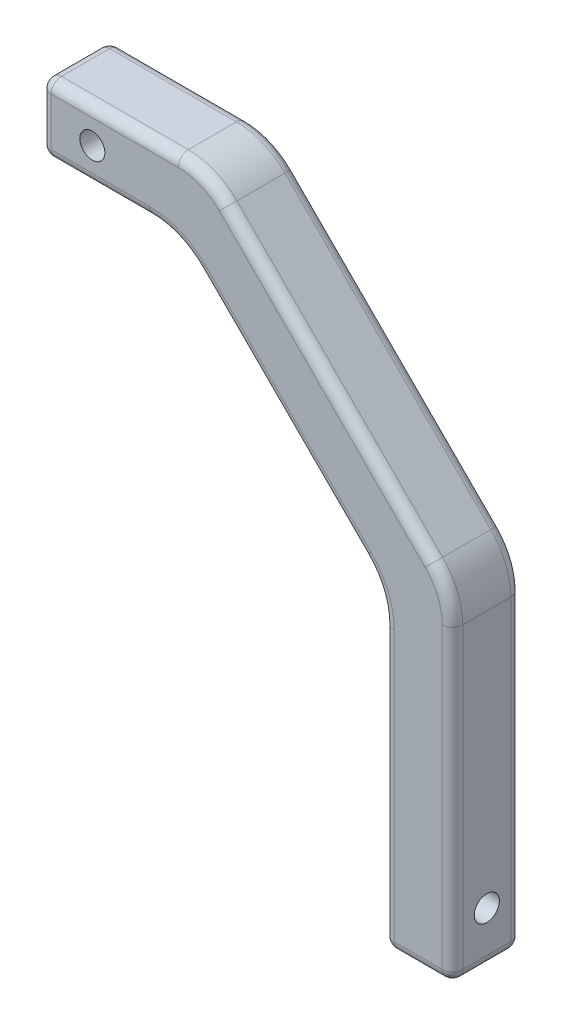
from build123d import *

# Parameters (mm, degrees)
CROQUIS1_R              = 3.65
SALIENTE_EXTRUIR1_DEPTH = 20
REDONDEO1_R             = 20
CROQUIS4_R              = 3.65
CORTAR_EXTRUIR3_DEPTH   = 20
REDONDEO2_R             = 3


with BuildPart() as part:
    # Croquis1 → Saliente-Extruir1 (new body)
    with BuildSketch(Plane.XY):
        Polygon((-60, 0), (-11.715728753, 0), (60, -71.715728753), (60, -170), (40, -170), (40, -80), (-20, -20), (-60, -20), align=None)
        with Locations((-45, -10)):
            Circle(CROQUIS1_R, mode=Mode.SUBTRACT)
    extrude(amount=SALIENTE_EXTRUIR1_DEPTH)

    # Redondeo1
    redondeo1_edges = [part.edges().sort_by_distance(p)[0] for p in [
        (40, -80, 10),
        (60, -71.715728753, 10),
        (-20, -20, 10),
        (-11.715728753, 0, 10),
    ]]
    fillet(redondeo1_edges, radius=REDONDEO1_R)

    # Croquis4 → Cortar-Extruir3 (cut)
    with BuildSketch(Plane.ZY.offset(-40)):
        with Locations((10, -155)):
            Circle(CROQUIS4_R)
    extrude(amount=-CORTAR_EXTRUIR3_DEPTH, mode=Mode.SUBTRACT)

    # Redondeo2
    redondeo2_edges = [part.edges().sort_by_distance(p)[0] for p in [
        (-40, 0, 20),
        (-12.346331353, -1.52240935, 20),
        (60, -125, 20),
        (58.47759065, -72.346331353, 20),
        (40, -129.142135624, 20),
        (38.47759065, -80.6306026, 20),
        (-44.142135624, -20, 20),
        (-20.6306026, -21.52240935, 20),
        (-40, 0, 0),
        (-12.346331353, -1.52240935, 0),
        (60, -125, 0),
        (58.47759065, -72.346331353, 0),
        (40, -129.142135624, 0),
        (38.47759065, -80.6306026, 0),
        (-44.142135624, -20, 0),
        (-20.6306026, -21.52240935, 0),
        (24.142135624, -35.857864376, 20),
        (10, -50, 20),
        (24.142135624, -35.857864376, 0),
        (10, -50, 0),
        (40, -170, 10),
        (50, -170, 0),
        (50, -170, 20),
        (60, -170, 10),
        (-60, -20, 10),
        (-60, -10, 0),
        (-60, -10, 20),
        (-60, 0, 10),
    ]]
    fillet(redondeo2_edges, radius=REDONDEO2_R)


solid = part.part
